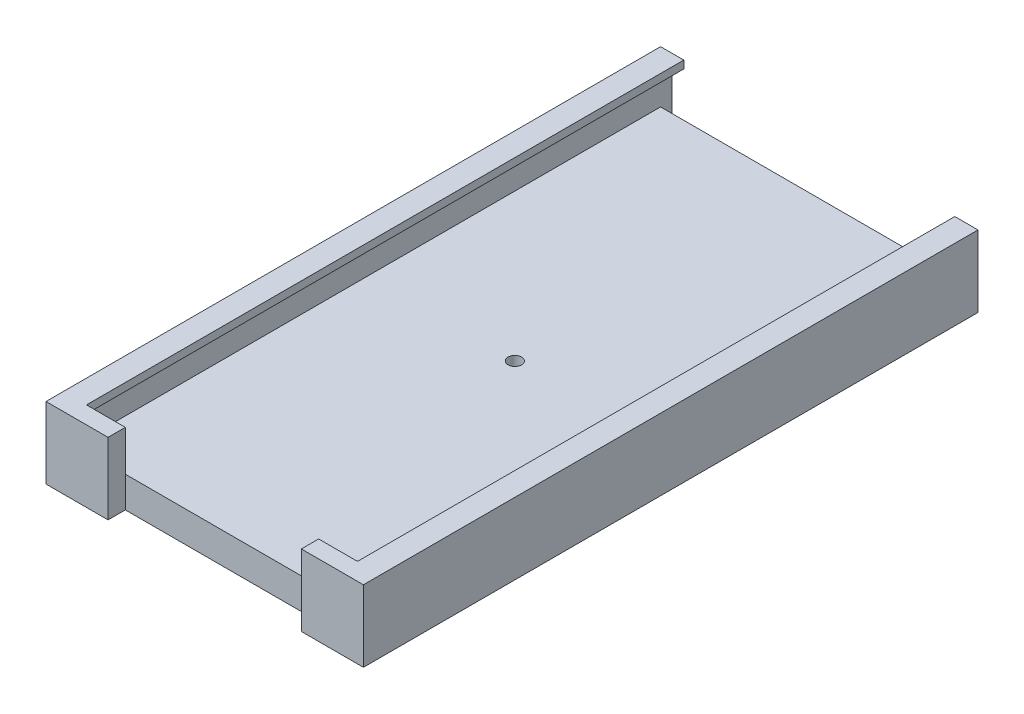
from build123d import *

# Parameters (mm, degrees)
SKETCH1_W                   = 76.1
SKETCH1_H                   = 151.5
BOSS_EXTRUDE2_DEPTH         = 8
SKETCH1_4_W                 = 76.1
SKETCH1_4_H                 = 3
BOSS_EXTRUDE3_DEPTH         = 18.5
CUT_EXTRUDE_THIN1_START     = -8
CUT_EXTRUDE_THIN1_OUTLINE_W = 50
CUT_EXTRUDE_THIN1_OUTLINE_H = 4.46993239
CUT_EXTRUDE_THIN1_DEPTH     = 18.5
SKETCH4_W                   = 76.1
SKETCH4_H                   = 3
CUT_EXTRUDE1_DEPTH          = 16.5
SKETCH6_W                   = 154.5
SKETCH6_H                   = 2
BOSS_EXTRUDE4_DEPTH         = 3
SKETCH7_W                   = 154.5
SKETCH7_H                   = 2
BOSS_EXTRUDE5_DEPTH         = 3
CUT_EXTRUDE2_DEPTH          = 3
CUT_EXTRUDE2_DEPTH_BACK     = 76.1
SKETCH8_R                   = 1.75


# Read off the part's stored shape, not the designer's step: Cut-Extrude-Thin1
with BuildPart() as part:
    # Sketch1 → Boss-Extrude2 (new body)
    with BuildSketch(Plane(origin=(0, 0, 0), x_dir=(1, 0, 0), z_dir=(0, 1, 0))):
        with Locations((38.05, -75.75)):
            Rectangle(SKETCH1_W, SKETCH1_H)
    extrude(amount=BOSS_EXTRUDE2_DEPTH)

    # Sketch1<4> → Boss-Extrude3 (add)
    with BuildSketch(Plane(origin=(0, 0, 0), x_dir=(1, 0, 0), z_dir=(0, 1, 0))):
        Polygon((0, -151.5), (-3, -151.5), (-3, -155.96993239), (79.1, -155.96993239), (79.1, -151.5), (76.1, -151.5), align=None)
        Polygon((0, 3), (-3, 3), (-3, -151.5), (0, -151.5), (0, 0), align=None)
        Polygon((79.1, 3), (79.1, -151.5), (76.1, -151.5), (76.1, 0), (76.1, 3), align=None)
        with Locations((38.05, 1.5)):
            Rectangle(SKETCH1_4_W, SKETCH1_4_H)
    extrude(amount=BOSS_EXTRUDE3_DEPTH)

    # Cut-Extrude-Thin1 outline → Cut-Extrude-Thin1 (cut)
    with BuildSketch(Plane(origin=(0, 8, 0), x_dir=(1, 0, 0), z_dir=(0, 1, 0)).offset(CUT_EXTRUDE_THIN1_START)):
        with Locations((38.05, -153.734966195)):
            Rectangle(CUT_EXTRUDE_THIN1_OUTLINE_W, CUT_EXTRUDE_THIN1_OUTLINE_H)
    extrude(amount=CUT_EXTRUDE_THIN1_DEPTH, mode=Mode.SUBTRACT)

    # Sketch4 → Cut-Extrude1 (cut)
    with BuildSketch(Plane(origin=(0, 18.5, 0), x_dir=(1, 0, 0), z_dir=(0, 1, 0))):
        with Locations((38.05, 1.5)):
            Rectangle(SKETCH4_W, SKETCH4_H)
    extrude(amount=-CUT_EXTRUDE1_DEPTH, mode=Mode.SUBTRACT)

    # Sketch6 → Boss-Extrude4 (add)
    with BuildSketch(Plane(origin=(0, 0, 0), x_dir=(0, 0, -1), z_dir=(1, 0, 0))):
        with Locations((-74.25, 17.5)):
            Rectangle(SKETCH6_W, SKETCH6_H)
    extrude(amount=BOSS_EXTRUDE4_DEPTH)

    # Sketch7 → Boss-Extrude5 (add)
    with BuildSketch(Plane.ZY.offset(-76.1)):
        with Locations((74.25, 17.5)):
            Rectangle(SKETCH7_W, SKETCH7_H)
    extrude(amount=BOSS_EXTRUDE5_DEPTH)

    # Sketch8 → Cut-Extrude2 (cut, two sides: drawn at the far end of the back side and taken through both)
    with BuildSketch(Plane(origin=(0, 8, 0), x_dir=(1, 0, 0), z_dir=(0, 1, 0)).offset(-CUT_EXTRUDE2_DEPTH_BACK)):
        with Locations(Location((38.05, -75.75, 0), (0, 0, 270))):
            Circle(SKETCH8_R)
    extrude(amount=CUT_EXTRUDE2_DEPTH + CUT_EXTRUDE2_DEPTH_BACK, mode=Mode.SUBTRACT)


solid = part.part
